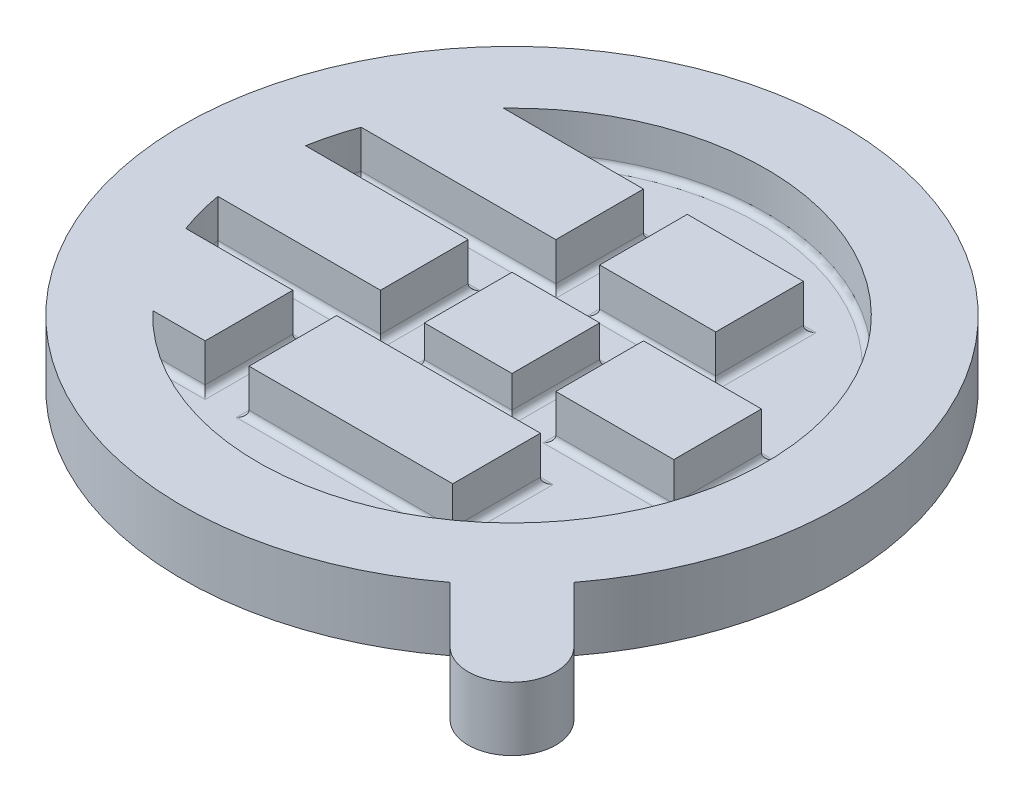
from build123d import *

# Parameters (mm, degrees)
BOSS_EXTRUDE12_DEPTH = 3
SKETCH1_16_W         = 18.27
SKETCH1_16_H         = 13.8
SKETCH1_16_W_2       = 18.57
SKETCH1_16_W_3       = 32.07
BOSS_EXTRUDE13_DEPTH = 10
SKETCH1_17_W         = 13.8
SKETCH1_17_H         = 13.8
BOSS_EXTRUDE14_DEPTH = 9
FILLET1_R            = 1


with BuildPart() as part:
    # Sketch1 → Boss-Extrude12 (new body)
    with BuildSketch(Plane(origin=(0, 0, 0), x_dir=(1, 0, 0), z_dir=(0, 1, 0))):
        with BuildLine():
            Line((81.494030169, 8.747896251), (90.24192642, 0))
            ThreePointArc((90.24192642, 0), (100, 0), (100, 9.75807358))
            Line((100, 9.75807358), (91.252103749, 18.505969831))
            ThreePointArc((91.252103749, 18.505969831), (13.301158056, 86.698841944), (81.494030169, 8.747896251))
        make_face()
    extrude(amount=BOSS_EXTRUDE12_DEPTH)

    # Sketch1<16> → Boss-Extrude13 (add)
    # profile 1 of 4: a face of its own
    with BuildSketch(Plane(origin=(0, 0, 0), x_dir=(1, 0, 0), z_dir=(0, 1, 0))):
        with BuildLine():
            Line((81.494030169, 8.747896251), (90.24192642, 0))
            ThreePointArc((90.24192642, 0), (100, 0), (100, 9.75807358))
            Line((100, 9.75807358), (91.252103749, 18.505969831))
            ThreePointArc((91.252103749, 18.505969831), (13.301158056, 86.698841944), (81.494030169, 8.747896251))
        make_face()
        with BuildLine():
            Line((21.047625313, 22.4), (29.3, 22.4))
            Line((29.3, 22.4), (29.3, 36.2))
            Line((29.3, 36.2), (12.455892606, 36.2))
            ThreePointArc((12.455892606, 36.2), (11.37337625, 39.608467983), (10.599619291, 43.1))
            Line((10.599619291, 43.1), (36.2, 43.1))
            Line((36.2, 43.1), (36.2, 56.9))
            Line((36.2, 56.9), (10.599619291, 56.9))
            ThreePointArc((10.599619291, 56.9), (11.37337625, 60.391532017), (12.455892606, 63.8))
            Line((12.455892606, 63.8), (43.1, 63.8))
            Line((43.1, 63.8), (43.1, 77.6))
            Line((43.1, 77.6), (21.047625313, 77.6))
            ThreePointArc((21.047625313, 77.6), (90, 50), (21.047625313, 22.4))
        make_face(mode=Mode.SUBTRACT)
    # profile 2 of 4: a face of its own
    with BuildSketch(Plane(origin=(0, 0, 0), x_dir=(1, 0, 0), z_dir=(0, 1, 0))):
        with Locations((59.135, 70.7)):
            Rectangle(SKETCH1_16_W, SKETCH1_16_H)
    # profile 3 of 4: a face of its own
    with BuildSketch(Plane(origin=(0, 0, 0), x_dir=(1, 0, 0), z_dir=(0, 1, 0))):
        with Locations((73.085, 50)):
            Rectangle(SKETCH1_16_W_2, SKETCH1_16_H)
    # profile 4 of 4: a face of its own
    with BuildSketch(Plane(origin=(0, 0, 0), x_dir=(1, 0, 0), z_dir=(0, 1, 0))):
        with Locations((52.235, 29.3)):
            Rectangle(SKETCH1_16_W_3, SKETCH1_16_H)
    extrude(amount=BOSS_EXTRUDE13_DEPTH)

    # Sketch1<17> → Boss-Extrude14 (add)
    with BuildSketch(Plane(origin=(0, 0, 0), x_dir=(1, 0, 0), z_dir=(0, 1, 0))):
        with Locations((50, 50)):
            Rectangle(SKETCH1_17_W, SKETCH1_17_H)
    extrude(amount=BOSS_EXTRUDE14_DEPTH)

    # Fillet1
    fillet1_edges = [part.edges().sort_by_distance(p)[0] for p in [
        (90, 3, -50),
        (36.2, 3, -29.3),
        (52.235, 3, -22.4),
        (50, 3, -70.7),
        (59.135, 3, -63.8),
        (43.1, 3, -50),
        (50, 3, -43.1),
        (63.8, 3, -50),
        (73.085, 3, -43.1),
        (50, 3, -56.9),
        (73.085, 3, -56.9),
        (56.9, 3, -50),
        (52.235, 3, -36.2),
        (68.27, 3, -29.3),
        (82.37, 3, -50),
        (68.27, 3, -70.7),
        (59.135, 3, -77.6),
        (32.073812657, 3, -77.6),
        (43.1, 3, -70.7),
        (27.777946303, 3, -63.8),
        (11.37337625, 3, -60.391532017),
        (23.399809646, 3, -56.9),
        (36.2, 3, -50),
        (23.399809646, 3, -43.1),
        (11.37337625, 3, -39.608467983),
        (20.877946303, 3, -36.2),
        (29.3, 3, -29.3),
        (25.173812657, 3, -22.4),
    ]]
    fillet(fillet1_edges, radius=FILLET1_R)


solid = part.part
